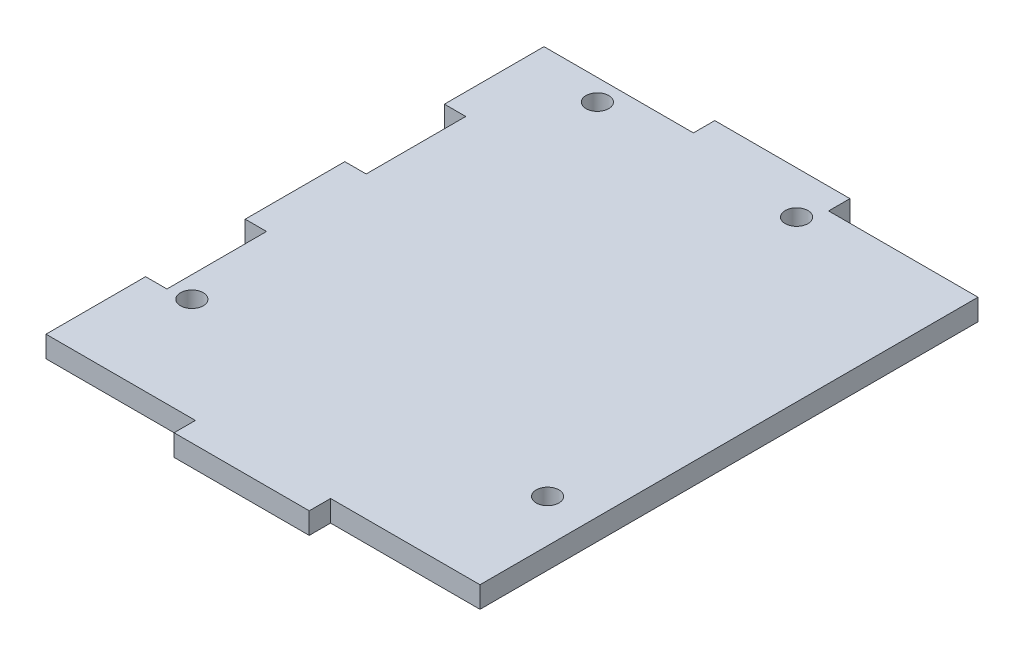
from build123d import *

# Parameters (mm, degrees)
SKETCH1_R           = 1.6
BOSS_EXTRUDE1_DEPTH = 3


with BuildPart() as part:
    # Sketch1 → Boss-Extrude1 (new body)
    with BuildSketch(Plane(origin=(0, 0, 0), x_dir=(1, 0, 0), z_dir=(0, 1, 0))):
        Polygon((0, 7), (0, -7), (3, -7), (3, -21), (0, -21), (0, -35), (21, -35), (21, -38), (40, -38), (40, -35), (61, -35), (61, 35), (40, 35), (40, 38), (21, 38), (21, 35), (0, 35), (0, 21), (3, 21), (3, 7), align=None)
        with Locations((6, -20.5)):
            Circle(SKETCH1_R, mode=Mode.SUBTRACT)
        with Locations((55, -19.5)):
            Circle(SKETCH1_R, mode=Mode.SUBTRACT)
        with Locations((10.5, 32)):
            Circle(SKETCH1_R, mode=Mode.SUBTRACT)
        with Locations((38.5, 32)):
            Circle(SKETCH1_R, mode=Mode.SUBTRACT)
    extrude(amount=BOSS_EXTRUDE1_DEPTH)


solid = part.part
